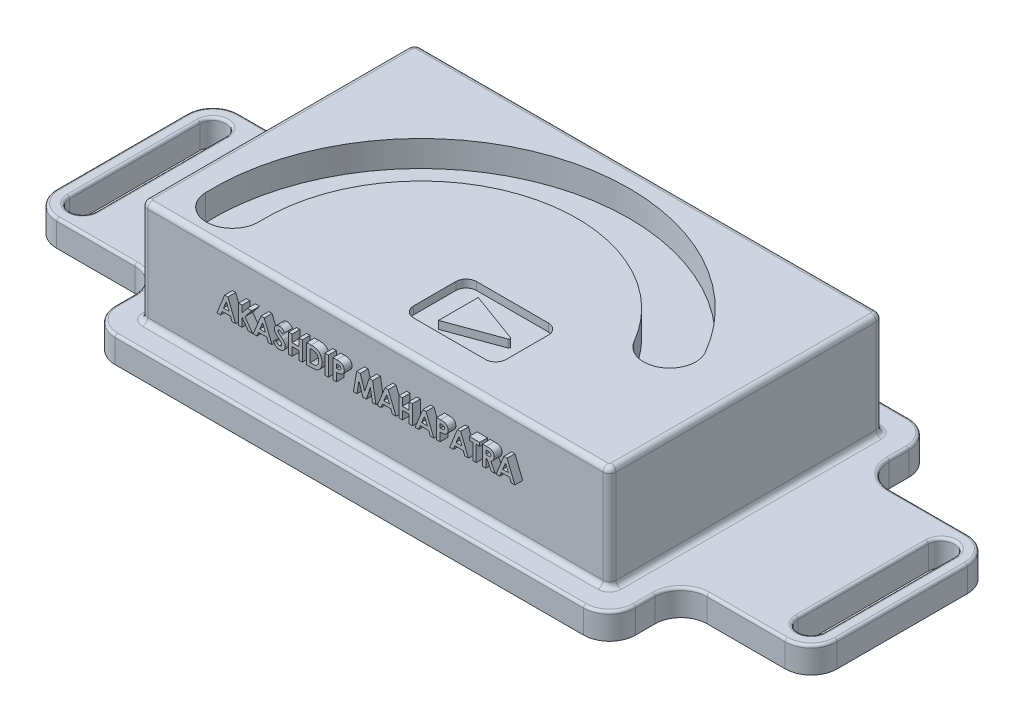
from build123d import *

# Parameters (mm, degrees)
SKETCH1_W           = 50
SKETCH1_H           = 70
BOSS_EXTRUDE1_DEPTH = 10
FILLET1_R           = 10
BOSS_EXTRUDE2_DEPTH = 40
FILLET2_R           = 2
CUT_EXTRUDE1_DEPTH  = 10
FILLET3_R           = 1
WRAP1_OUTLINE_W     = 1.329700854
WRAP1_OUTLINE_H     = 7.408333333
WRAP1_DEPTH         = 3
WRAP2_START         = -3
WRAP2_DEPTH         = 3


# Read off the part's stored shape, not the designer's step: Wrap1, Wrap2
with BuildPart() as part:
    # Sketch1 → Boss-Extrude1 (new body)
    # profile 1 of 5: a face of its own
    with BuildSketch(Plane(origin=(0, 0, 0), x_dir=(1, 0, 0), z_dir=(0, 1, 0))):
        with BuildLine():
            Line((140, 35), (100, 35))
            Line((100, 35), (100, -35))
            Line((100, -35), (140, -35))
            ThreePointArc((140, -35), (147.071067812, -32.071067812), (150, -25))
            Line((150, -25), (150, 25))
            ThreePointArc((150, 25), (147.071067812, 32.071067812), (140, 35))
        make_face()
        with BuildLine():
            Line((135, -25), (135, 25))
            ThreePointArc((135, 25), (140, 30), (145, 25))
            Line((145, 25), (145, -25))
            ThreePointArc((145, -25), (140, -30), (135, -25))
        make_face(mode=Mode.SUBTRACT)
    # profile 2 of 5: a face of its own
    with BuildSketch(Plane(origin=(0, 0, 0), x_dir=(1, 0, 0), z_dir=(0, 1, 0))):
        with Locations((75, 0)):
            Rectangle(SKETCH1_W, SKETCH1_H)
    # profile 3 of 5: a face of its own
    with BuildSketch(Plane(origin=(0, 0, 0), x_dir=(1, 0, 0), z_dir=(0, 1, 0))):
        with BuildLine():
            Line((90, 62.5), (-90, 62.5))
            ThreePointArc((-90, 62.5), (-97.071067812, 59.571067812), (-100, 52.5))
            Line((-100, 52.5), (-100, 35))
            Line((-100, 35), (-50, 35))
            Line((-50, 35), (-50, -35))
            Line((-50, -35), (-100, -35))
            Line((-100, -35), (-100, -52.5))
            ThreePointArc((-100, -52.5), (-97.071067812, -59.571067812), (-90, -62.5))
            Line((-90, -62.5), (90, -62.5))
            ThreePointArc((90, -62.5), (97.071067812, -59.571067812), (100, -52.5))
            Line((100, -52.5), (100, -35))
            Line((100, -35), (50, -35))
            Line((50, -35), (50, 35))
            Line((50, 35), (100, 35))
            Line((100, 35), (100, 52.5))
            ThreePointArc((100, 52.5), (97.071067812, 59.571067812), (90, 62.5))
        make_face()
    # profile 4 of 5: a face of its own
    with BuildSketch(Plane(origin=(0, 0, 0), x_dir=(1, 0, 0), z_dir=(0, 1, 0))):
        with Locations((-75, 0)):
            Rectangle(SKETCH1_W, SKETCH1_H)
    # profile 5 of 5: a face of its own
    with BuildSketch(Plane(origin=(0, 0, 0), x_dir=(1, 0, 0), z_dir=(0, 1, 0))):
        with BuildLine():
            Line((-100, -35), (-100, 35))
            Line((-100, 35), (-140, 35))
            ThreePointArc((-140, 35), (-147.071067812, 32.071067812), (-150, 25))
            Line((-150, 25), (-150, -25))
            ThreePointArc((-150, -25), (-147.071067812, -32.071067812), (-140, -35))
            Line((-140, -35), (-100, -35))
        make_face()
        with BuildLine():
            ThreePointArc((-145, 25), (-140, 30), (-135, 25))
            Line((-135, 25), (-135, -25))
            ThreePointArc((-135, -25), (-140, -30), (-145, -25))
            Line((-145, -25), (-145, 25))
        make_face(mode=Mode.SUBTRACT)
    extrude(amount=BOSS_EXTRUDE1_DEPTH)

    # Fillet1
    fillet1_edges = [part.edges().sort_by_distance(p)[0] for p in [
        (100, 5, -35),
        (100, 5, 35),
        (-100, 5, 35),
        (-100, 5, -35),
    ]]
    fillet(fillet1_edges, radius=FILLET1_R)

    # Sketch2 → Boss-Extrude2 (add)
    with BuildSketch(Plane(origin=(0, 10, 0), x_dir=(1, 0, 0), z_dir=(0, 1, 0))):
        with BuildLine():
            Line((-87.5, 52.5), (87.5, 52.5))
            ThreePointArc((87.5, 52.5), (89.267766953, 51.767766953), (90, 50))
            Line((90, 50), (90, -50))
            ThreePointArc((90, -50), (89.267766953, -51.767766953), (87.5, -52.5))
            Line((87.5, -52.5), (-87.5, -52.5))
            ThreePointArc((-87.5, -52.5), (-89.267766953, -51.767766953), (-90, -50))
            Line((-90, -50), (-90, 50))
            ThreePointArc((-90, 50), (-89.267766953, 51.767766953), (-87.5, 52.5))
        make_face()
    extrude(amount=BOSS_EXTRUDE2_DEPTH)

    # Fillet2
    fillet2_edges = [part.edges().sort_by_distance(p)[0] for p in [
        (89.267766953, 10, -51.767766953),
        (0, 10, -52.5),
        (-89.267766953, 10, -51.767766953),
        (-90, 10, 0),
        (-89.267766953, 10, 51.767766953),
        (0, 10, 52.5),
        (89.267766953, 10, 51.767766953),
        (90, 10, 0),
        (89.267766953, 50, -51.767766953),
        (0, 50, -52.5),
        (-89.267766953, 50, -51.767766953),
        (-90, 50, 0),
        (-89.267766953, 50, 51.767766953),
        (0, 50, 52.5),
        (89.267766953, 50, 51.767766953),
        (90, 50, 0),
    ]]
    fillet(fillet2_edges, radius=FILLET2_R)

    # Sketch3 → Cut-Extrude1 (cut)
    with BuildSketch(Plane(origin=(0, 50, 0), x_dir=(1, 0, 0), z_dir=(0, 1, 0))):
        with BuildLine():
            ThreePointArc((69.282032303, 5), (-22.082335197, 41.891940229), (-79.948963312, -37.857142857))
            ThreePointArc((-79.948963312, -37.857142857), (-69.598200041, -47.493620414), (-59.961722484, -37.142857143))
            ThreePointArc((-59.961722484, -37.142857143), (-16.561751398, 22.668955172), (51.961524227, -5))
            ThreePointArc((51.961524227, -5), (65.621778265, -8.660254038), (69.282032303, 5))
        make_face()
    extrude(amount=-CUT_EXTRUDE1_DEPTH, mode=Mode.SUBTRACT)

    # Fillet3
    fillet3_edges = [part.edges().sort_by_distance(p)[0] for p in [
        (145, 10, 0),
        (140, 10, 30),
        (135, 10, 0),
        (140, 10, -30),
        (-140, 10, 30),
        (-145, 10, 0),
        (-140, 10, -30),
        (-135, 10, 0),
        (-147.071067812, 10, -32.071067812),
        (-150, 10, 0),
        (-147.071067812, 10, 32.071067812),
        (-97.071067812, 10, 59.571067812),
        (0, 10, 62.5),
        (97.071067812, 10, 59.571067812),
        (147.071067812, 10, 32.071067812),
        (-100, 10, -48.75),
        (150, 10, 0),
        (147.071067812, 10, -32.071067812),
        (-125, 10, -35),
        (100, 10, -48.75),
        (-100, 10, 48.75),
        (-125, 10, 35),
        (97.071067812, 10, -59.571067812),
        (125, 10, -35),
        (125, 10, 35),
        (100, 10, 48.75),
        (-102.928932188, 10, -37.928932188),
        (0, 10, -62.5),
        (-102.928932188, 10, 37.928932188),
        (102.928932188, 10, -37.928932188),
        (102.928932188, 10, 37.928932188),
        (-97.071067812, 10, -59.571067812),
    ]]
    fillet(fillet3_edges, radius=FILLET3_R)

    # Wrap1 outline → Wrap1 (add)
    # profile 1 of 17: a face of its own
    with BuildSketch(Plane.XY.offset(52.5)):
        with BuildLine():
            add(Edge.make_bspline(
                [(-32.85559952, 35.308802516), (-32.898191392, 35.36888278), (-32.979961848, 35.484228508), (-33.112503227, 35.638679156), (-33.244446113, 35.770437053), (-33.377012878, 35.878951776), (-33.511378543, 35.963564016), (-33.647309868, 36.023470416), (-33.784036222, 36.061553483), (-33.875895225, 36.066295741), (-33.921141053, 36.068631576)],
                knots=[0, 0, 0, 0, 0.162420307, 0.31182434, 0.448432767, 0.573381197, 0.689077147, 0.797572901, 0.900293043, 1, 1, 1, 1], degree=3))
            Line((-32.85559952, 35.308802516), (-31.861291961, 36.21851973))
            add(Edge.make_bspline(
                [(-33.906300642, 37.39833243), (-33.81901379, 37.395139291), (-33.645129099, 37.388778219), (-33.388035568, 37.339036711), (-33.136917356, 37.26081295), (-32.934561594, 37.166444588), (-32.773550892, 37.075029912), (-32.650151229, 36.990866793), (-32.52458543, 36.894453417), (-32.395840884, 36.785485959), (-32.266309865, 36.66191133), (-32.132309186, 36.526671322), (-31.99566477, 36.378597143), (-31.906867565, 36.272813637), (-31.861291961, 36.21851973)],
                knots=[0, 0, 0, 0, 0.10691022, 0.212976528, 0.319776676, 0.428556273, 0.485856803, 0.546558687, 0.611431498, 0.67982091, 0.753158505, 0.830752869, 0.913133075, 1, 1, 1, 1], degree=3))
            add(Edge.make_bspline(
                [(-35.850394525, 35.519536357), (-35.848787564, 35.582962532), (-35.845621677, 35.707918912), (-35.817381475, 35.891649061), (-35.775175419, 36.068933217), (-35.713880108, 36.239124567), (-35.634326195, 36.402009939), (-35.537711058, 36.558386726), (-35.422534447, 36.706815671), (-35.292738182, 36.847198377), (-35.14973593, 36.975492194), (-34.99691985, 37.088724343), (-34.835154895, 37.184361862), (-34.665430662, 37.263700129), (-34.48669544, 37.324428532), (-34.300265962, 37.367475851), (-34.105874831, 37.393079024), (-33.97365418, 37.396559478), (-33.906300642, 37.39833243)],
                knots=[0, 0, 0, 0, 0.06317288, 0.12445736, 0.184840915, 0.244566821, 0.304319173, 0.365199786, 0.427420983, 0.491261689, 0.555499002, 0.618604518, 0.680494764, 0.742473305, 0.804990665, 0.868251971, 0.932887217, 1, 1, 1, 1], degree=3))
            add(Edge.make_bspline(
                [(-33.983470781, 32.919496292), (-34.077766347, 32.999279384), (-34.25874808, 33.152407284), (-34.514498229, 33.378572373), (-34.744952014, 33.589944372), (-34.948118987, 33.7891363), (-35.12658781, 33.972469546), (-35.279149814, 34.14143321), (-35.404129037, 34.297330618), (-35.53564272, 34.481980665), (-35.660607013, 34.706989435), (-35.768611624, 34.97770107), (-35.838680457, 35.248378355), (-35.846530696, 35.430096176), (-35.850394525, 35.519536357)],
                knots=[0, 0, 0, 0, 0.112124581, 0.215201009, 0.309902452, 0.395959096, 0.473447494, 0.542140328, 0.602523333, 0.654726333, 0.747804055, 0.835278417, 0.918925243, 1, 1, 1, 1], degree=3))
            add(Edge.make_bspline(
                [(-33.001035551, 31.641736877), (-33.003474883, 31.684010443), (-33.008430152, 31.769885145), (-33.044929139, 31.897567017), (-33.101988188, 32.025190823), (-33.169493067, 32.129871321), (-33.238187734, 32.217517464), (-33.30387533, 32.293458882), (-33.383865445, 32.377360855), (-33.47795526, 32.469328924), (-33.584901602, 32.570172707), (-33.704794561, 32.67988233), (-33.839007038, 32.797491382), (-33.933868681, 32.877605506), (-33.983470781, 32.919496292)],
                knots=[0, 0, 0, 0, 0.076346606, 0.155090822, 0.238351561, 0.32840414, 0.37938386, 0.439617644, 0.509831416, 0.588874645, 0.677436354, 0.77554672, 0.882635872, 1, 1, 1, 1], degree=3))
            add(Edge.make_bspline(
                [(-33.846938996, 30.939785422), (-33.78928309, 30.942117175), (-33.677422234, 30.946641115), (-33.517755177, 30.98842739), (-33.371366373, 31.054034907), (-33.244828973, 31.147647786), (-33.13768508, 31.255691277), (-33.058606737, 31.375894601), (-33.008929188, 31.505951696), (-33.003677067, 31.596297909), (-33.001035551, 31.641736877)],
                knots=[0, 0, 0, 0, 0.141985893, 0.275473311, 0.404345843, 0.535429711, 0.661427401, 0.77786684, 0.888279749, 1, 1, 1, 1], degree=3))
            add(Edge.make_bspline(
                [(-35.060884643, 31.889571747), (-35.01770716, 31.814518951), (-34.934932236, 31.670636327), (-34.794662389, 31.477311785), (-34.650963091, 31.311761316), (-34.500512144, 31.176911036), (-34.345138975, 31.070957821), (-34.184093096, 30.995236304), (-34.017261358, 30.94836477), (-33.903623157, 30.942640673), (-33.846938996, 30.939785422)],
                knots=[0, 0, 0, 0, 0.160457921, 0.307611547, 0.442138888, 0.566229194, 0.681222208, 0.789558005, 0.895028892, 1, 1, 1, 1], degree=3))
            Line((-35.060884643, 31.889571747), (-36.230309055, 31.187620291))
            add(Edge.make_bspline(
                [(-33.895912354, 29.610084567), (-33.959273199, 29.611208631), (-34.084764011, 29.613434921), (-34.269718496, 29.631610731), (-34.448312959, 29.660944554), (-34.620346229, 29.702988685), (-34.786593347, 29.756264302), (-34.947061141, 29.821338426), (-35.100641847, 29.899219684), (-35.248497531, 29.988306526), (-35.389909431, 30.091748084), (-35.526665644, 30.20742953), (-35.65740778, 30.337130096), (-35.782763765, 30.480543045), (-35.901931537, 30.638074488), (-36.018811884, 30.807530508), (-36.128210293, 30.99205598), (-36.195790557, 31.121502091), (-36.230309055, 31.187620291)],
                knots=[0, 0, 0, 0, 0.063551482, 0.125868382, 0.18624025, 0.244976651, 0.303357688, 0.361230317, 0.418489049, 0.475936712, 0.534203744, 0.594059429, 0.655468694, 0.718771685, 0.784974607, 0.853522316, 0.925182451, 1, 1, 1, 1], degree=3))
            add(Edge.make_bspline(
                [(-31.671334696, 31.718907016), (-31.672660799, 31.644086191), (-31.675262662, 31.497284947), (-31.707130492, 31.282463193), (-31.752572147, 31.076869451), (-31.822832917, 30.882740872), (-31.908466328, 30.696890894), (-32.015820176, 30.522214469), (-32.141892551, 30.3569438), (-32.28639085, 30.204033302), (-32.446223127, 30.065277624), (-32.617658434, 29.941754041), (-32.802373152, 29.839769591), (-32.998789108, 29.75579267), (-33.206801164, 29.691112522), (-33.426161516, 29.643307865), (-33.65720569, 29.614616264), (-33.815197025, 29.611616897), (-33.895912354, 29.610084567)],
                knots=[0, 0, 0, 0, 0.065200875, 0.127926544, 0.18904691, 0.248543693, 0.307607127, 0.36724766, 0.426963056, 0.488617128, 0.550391855, 0.611330734, 0.672556085, 0.734024191, 0.797340621, 0.862249627, 0.929625466, 1, 1, 1, 1], degree=3))
            add(Edge.make_bspline(
                [(-32.437099921, 33.418134113), (-32.3716958, 33.347352847), (-32.245966112, 33.211286397), (-32.082561839, 33.000426191), (-31.948074838, 32.794583635), (-31.844033143, 32.589885467), (-31.76545667, 32.383378299), (-31.710059216, 32.169997556), (-31.676881312, 31.947513542), (-31.67319779, 31.795695362), (-31.671334696, 31.718907016)],
                knots=[0, 0, 0, 0, 0.150833097, 0.289954183, 0.417138648, 0.535255184, 0.648751095, 0.762405462, 0.879826701, 1, 1, 1, 1], degree=3))
            add(Edge.make_bspline(
                [(-33.391338369, 34.272941805), (-33.329020209, 34.219008581), (-33.210753288, 34.116654526), (-33.042482945, 33.97137938), (-32.894601339, 33.840678873), (-32.764954172, 33.72651454), (-32.655506768, 33.627688536), (-32.565799011, 33.543728475), (-32.494735272, 33.476268904), (-32.454339698, 33.435523281), (-32.437099921, 33.418134113)],
                knots=[0, 0, 0, 0, 0.192952702, 0.366184141, 0.520457298, 0.655012135, 0.770624226, 0.865677185, 0.942674527, 1, 1, 1, 1], degree=3))
            add(Edge.make_bspline(
                [(-34.397518257, 35.228664295), (-34.380480757, 35.207155254), (-34.341262682, 35.157644282), (-34.266481845, 35.07922662), (-34.172572819, 34.983158121), (-34.055921788, 34.872742297), (-33.921371255, 34.744008166), (-33.762684631, 34.602016313), (-33.584429609, 34.442369417), (-33.457730068, 34.3311971), (-33.391338369, 34.272941805)],
                knots=[0, 0, 0, 0, 0.059234189, 0.136349281, 0.233805212, 0.349411224, 0.48317915, 0.635966856, 0.809243356, 1, 1, 1, 1], degree=3))
            add(Edge.make_bspline(
                [(-34.520693671, 35.583350125), (-34.519384942, 35.552514552), (-34.516749344, 35.490415991), (-34.491293053, 35.399402818), (-34.452923155, 35.310472353), (-34.416259151, 35.256336147), (-34.397518257, 35.228664295)],
                knots=[0, 0, 0, 0, 0.241881375, 0.487115475, 0.73783784, 1, 1, 1, 1], degree=3))
            add(Edge.make_bspline(
                [(-33.921141053, 36.068631576), (-33.963345064, 36.067151484), (-34.04482992, 36.064293816), (-34.160992627, 36.035888808), (-34.264123533, 35.986865935), (-34.354121986, 35.922764405), (-34.425414039, 35.845536922), (-34.482335215, 35.764545149), (-34.51438662, 35.675148549), (-34.518605216, 35.613747357), (-34.520693671, 35.583350125)],
                knots=[0, 0, 0, 0, 0.148126258, 0.285992887, 0.416634394, 0.547379946, 0.671582838, 0.784400739, 0.893265576, 1, 1, 1, 1], degree=3))
        make_face()
    # profile 2 of 17: a face of its own
    with BuildSketch(Plane.XY.offset(52.5)):
        with BuildLine():
            add(Edge.make_bspline(
                [(-21.732711232, 37.208375165), (-21.602088105, 37.207462065), (-21.349592122, 37.205697032), (-20.983775396, 37.185809351), (-20.643612392, 37.155223509), (-20.328883833, 37.113147141), (-20.040234965, 37.057468584), (-19.778037995, 36.987630747), (-19.541412926, 36.907014582), (-19.327765213, 36.812153306), (-19.132725401, 36.701554479), (-18.947528875, 36.578356265), (-18.772539263, 36.438045553), (-18.605300864, 36.283329217), (-18.447971924, 36.111376768), (-18.297932353, 35.925036364), (-18.158855801, 35.721605809), (-18.026538283, 35.505962728), (-17.906874696, 35.277193245), (-17.802499643, 35.0372446), (-17.715064029, 34.78766095), (-17.644018064, 34.528176305), (-17.587386231, 34.259652075), (-17.547762079, 33.981546402), (-17.523266033, 33.694116767), (-17.520781114, 33.499311591), (-17.519518457, 33.400325619)],
                knots=[0, 0, 0, 0, 0.060148162, 0.116267077, 0.168653955, 0.217398969, 0.262433523, 0.303932701, 0.342259967, 0.377441339, 0.411406099, 0.445398351, 0.479766387, 0.514584482, 0.550213651, 0.587000908, 0.624662987, 0.663615456, 0.703456428, 0.743450162, 0.784013386, 0.825132536, 0.867264663, 0.910306473, 0.954424205, 1, 1, 1, 1], degree=3))
            Line((-21.732711232, 37.208375165), (-23.408193671, 37.208375165))
            Line((-23.408193671, 37.208375165), (-23.408193671, 29.800041832))
            Line((-23.408193671, 29.800041832), (-21.707482533, 29.800041832))
            add(Edge.make_bspline(
                [(-17.519518457, 33.400325619), (-17.522824775, 33.260649971), (-17.529333455, 32.98569028), (-17.584158939, 32.582190102), (-17.672830311, 32.195394936), (-17.797510313, 31.828330446), (-17.95208014, 31.484265393), (-18.136731107, 31.169267222), (-18.348755801, 30.885026682), (-18.585684121, 30.632959058), (-18.842219788, 30.41630352), (-19.108812077, 30.230753906), (-19.388058082, 30.084432552), (-19.634112838, 29.991642933), (-19.847473009, 29.933935818), (-20.03480093, 29.899830357), (-20.247586336, 29.868553593), (-20.487813264, 29.844383582), (-20.754427891, 29.822829872), (-21.048492947, 29.811118425), (-21.369056333, 29.801387951), (-21.591717914, 29.800502296), (-21.707482533, 29.800041832)],
                knots=[0, 0, 0, 0, 0.065772947, 0.129477895, 0.191430088, 0.252445668, 0.311786958, 0.36881755, 0.424091518, 0.478492106, 0.531393744, 0.58200397, 0.631201271, 0.679503008, 0.705561374, 0.735221723, 0.769132486, 0.80685832, 0.848929771, 0.895116661, 0.945469804, 1, 1, 1, 1], degree=3))
        make_face()
        with BuildLine():
            add(Edge.make_bspline(
                [(-21.383961566, 31.129742687), (-21.301323014, 31.129894115), (-21.142381567, 31.130185361), (-20.912906096, 31.144057685), (-20.70069947, 31.157981673), (-20.506345845, 31.184409867), (-20.328430776, 31.213849016), (-20.16939835, 31.254817622), (-20.025970217, 31.297851672), (-19.899898324, 31.352639352), (-19.784426742, 31.414306532), (-19.677513247, 31.486556782), (-19.574311791, 31.566787961), (-19.476751808, 31.65735978), (-19.384464058, 31.757072899), (-19.297994572, 31.866441096), (-19.216189213, 31.985130684), (-19.141147768, 32.113769205), (-19.072574495, 32.250998208), (-19.011742317, 32.395488428), (-18.961303465, 32.54844316), (-18.919381779, 32.708430561), (-18.889423981, 32.876843505), (-18.864639618, 33.05243458), (-18.851862556, 33.235899463), (-18.850108984, 33.360735101), (-18.849219312, 33.424070278)],
                knots=[0, 0, 0, 0, 0.062614648, 0.120428813, 0.174199486, 0.223724664, 0.26902845, 0.310765001, 0.348115258, 0.382378114, 0.414753161, 0.447195432, 0.480044579, 0.513738641, 0.547962504, 0.582917814, 0.619315101, 0.657123545, 0.695686576, 0.735513716, 0.7758232, 0.817652262, 0.860742584, 0.905386927, 0.951998197, 1, 1, 1, 1], degree=3))
            Line((-21.383961566, 31.129742687), (-22.078492816, 31.129742687))
            Line((-22.078492816, 31.129742687), (-22.078492816, 35.878674311))
            Line((-22.078492816, 35.878674311), (-21.570950749, 35.878674311))
            add(Edge.make_bspline(
                [(-19.548202685, 35.285057858), (-19.603304163, 35.333284987), (-19.715842692, 35.431783437), (-19.913423366, 35.549809769), (-20.131147037, 35.653507471), (-20.373994568, 35.735728183), (-20.639618946, 35.800751828), (-20.929602236, 35.845597046), (-21.242391513, 35.874414108), (-21.459084637, 35.877223819), (-21.570950749, 35.878674311)],
                knots=[0, 0, 0, 0, 0.101663476, 0.207636138, 0.318744567, 0.436679942, 0.563506646, 0.698681208, 0.844446556, 1, 1, 1, 1], degree=3))
            add(Edge.make_bspline(
                [(-18.849219312, 33.424070278), (-18.850991237, 33.521125449), (-18.854446353, 33.710375512), (-18.887766749, 33.986022361), (-18.942005996, 34.245585162), (-19.019400176, 34.48810061), (-19.116957939, 34.714250299), (-19.239074221, 34.922118263), (-19.380493607, 35.115196398), (-19.4923242, 35.228462226), (-19.548202685, 35.285057858)],
                knots=[0, 0, 0, 0, 0.142276686, 0.277428514, 0.406477152, 0.530595072, 0.650142922, 0.766850697, 0.883502093, 1, 1, 1, 1], degree=3))
        make_face(mode=Mode.SUBTRACT)
    # profile 3 of 17: a face of its own
    with BuildSketch(Plane.XY.offset(52.5)):
        with BuildLine():
            add(Edge.make_bspline(
                [(-11.856417495, 37.208375165), (-11.759452173, 37.207941128), (-11.572385741, 37.207103779), (-11.302620555, 37.196949806), (-11.053748963, 37.178753269), (-10.825828142, 37.156265227), (-10.618951808, 37.124737867), (-10.43286089, 37.088594217), (-10.267516768, 37.044560731), (-10.121054943, 36.992293595), (-9.989610186, 36.930672683), (-9.86522105, 36.865042013), (-9.750698746, 36.786714123), (-9.640262984, 36.704130861), (-9.540227569, 36.609403079), (-9.444351693, 36.508835049), (-9.35669596, 36.398438324), (-9.276854206, 36.279549228), (-9.204425432, 36.154364324), (-9.14114681, 36.022659816), (-9.089818736, 35.884227297), (-9.046760864, 35.739962268), (-9.012176361, 35.589871017), (-8.989155816, 35.433030468), (-8.973519103, 35.270535741), (-8.972139379, 35.159941728), (-8.971441534, 35.104004839)],
                knots=[0, 0, 0, 0, 0.070781161, 0.136551696, 0.197012482, 0.252922694, 0.303686532, 0.349719151, 0.391240471, 0.428478555, 0.463056565, 0.497150358, 0.531002334, 0.564226377, 0.59770067, 0.631421421, 0.665597347, 0.700451436, 0.735880684, 0.771092108, 0.806974845, 0.843534403, 0.880940196, 0.919294384, 0.95918024, 1, 1, 1, 1], degree=3))
            Line((-11.856417495, 37.208375165), (-13.340458628, 37.208375165))
            Line((-13.340458628, 37.208375165), (-13.340458628, 29.800041832))
            Line((-13.340458628, 29.800041832), (-12.010757773, 29.800041832))
            Line((-12.010757773, 29.800041832), (-12.010757773, 33.029315336))
            add(Edge.make_bspline(
                [(-10.501487941, 33.142102462), (-10.539465642, 33.132653549), (-10.621737572, 33.11218416), (-10.757875019, 33.091402592), (-10.914759132, 33.072295218), (-11.092897221, 33.055874743), (-11.292391987, 33.044712647), (-11.513050266, 33.035995546), (-11.754972058, 33.029657313), (-11.923194906, 33.029432405), (-12.010757773, 33.029315336)],
                knots=[0, 0, 0, 0, 0.077372749, 0.167614291, 0.272108317, 0.390015992, 0.52136331, 0.667272254, 0.826809521, 1, 1, 1, 1], degree=3))
            add(Edge.make_bspline(
                [(-8.971441534, 35.104004839), (-8.972451228, 35.042123191), (-8.974435401, 34.920518149), (-8.993886692, 34.742260075), (-9.027115643, 34.572307141), (-9.070544143, 34.409226104), (-9.131102099, 34.255700007), (-9.200286719, 34.108065671), (-9.285405747, 33.970462309), (-9.382667843, 33.84116867), (-9.488889149, 33.719133535), (-9.606591353, 33.607880437), (-9.733531, 33.506650968), (-9.868973283, 33.414384236), (-10.013426693, 33.331266363), (-10.166786998, 33.256519038), (-10.330101431, 33.192532913), (-10.443828688, 33.159068687), (-10.501487941, 33.142102462)],
                knots=[0, 0, 0, 0, 0.068875425, 0.135348675, 0.199289315, 0.26155008, 0.322915384, 0.382771997, 0.442843572, 0.502652029, 0.562748843, 0.622739582, 0.682687332, 0.743329247, 0.805012514, 0.86806712, 0.933110571, 1, 1, 1, 1], degree=3))
        make_face()
        with BuildLine():
            add(Edge.make_bspline(
                [(-11.540316734, 34.359016191), (-11.45471256, 34.359558988), (-11.297199608, 34.360557742), (-11.082092538, 34.375000311), (-10.909228359, 34.397057031), (-10.772662447, 34.428691468), (-10.664830725, 34.476700915), (-10.571832615, 34.532238805), (-10.492065763, 34.602464942), (-10.422999409, 34.68271032), (-10.36778294, 34.774916281), (-10.329493195, 34.87758143), (-10.30462093, 34.988548662), (-10.302323745, 35.065774511), (-10.301142389, 35.105488881)],
                knots=[0, 0, 0, 0, 0.155159592, 0.285495954, 0.390502806, 0.470975045, 0.538445527, 0.60365534, 0.666587169, 0.73019895, 0.794944675, 0.860228437, 0.928120706, 1, 1, 1, 1], degree=3))
            Line((-11.540316734, 34.359016191), (-12.010757773, 34.359016191))
            Line((-12.010757773, 34.359016191), (-12.010757773, 35.878674311))
            Line((-12.010757773, 35.878674311), (-11.592258174, 35.878674311))
            add(Edge.make_bspline(
                [(-10.649892055, 35.731754239), (-10.673409901, 35.743647888), (-10.723202001, 35.76882918), (-10.808002774, 35.798104274), (-10.905861571, 35.822801041), (-11.01743905, 35.843299119), (-11.142290096, 35.859207756), (-11.280392432, 35.871373884), (-11.431949291, 35.876266357), (-11.537348018, 35.877849521), (-11.592258174, 35.878674311)],
                knots=[0, 0, 0, 0, 0.08210116, 0.173824981, 0.278953094, 0.396639095, 0.527315592, 0.671298143, 0.82875438, 1, 1, 1, 1], degree=3))
            add(Edge.make_bspline(
                [(-10.301142389, 35.105488881), (-10.302311593, 35.140186808), (-10.304580131, 35.207509129), (-10.321245426, 35.304671938), (-10.347805114, 35.395247719), (-10.38628908, 35.478290529), (-10.436039736, 35.553659265), (-10.496695853, 35.621324236), (-10.567479094, 35.682734545), (-10.622127895, 35.71523996), (-10.649892055, 35.731754239)],
                knots=[0, 0, 0, 0, 0.137787685, 0.267341238, 0.390444331, 0.511777883, 0.629508981, 0.747829066, 0.87188531, 1, 1, 1, 1], degree=3))
        make_face(mode=Mode.SUBTRACT)
    # profile 4 of 17: a face of its own
    with BuildSketch(Plane.XY.offset(52.5)):
        with BuildLine():
            add(Edge.make_bspline(
                [(28.034608146, 37.208375165), (28.131573468, 37.207941128), (28.3186399, 37.207103779), (28.588405086, 37.196949806), (28.837276678, 37.178753269), (29.065197499, 37.156265227), (29.272073833, 37.124737867), (29.458164752, 37.088594217), (29.623508873, 37.044560731), (29.769970698, 36.992293595), (29.901415455, 36.930672683), (30.025804591, 36.865042013), (30.140326895, 36.786714123), (30.250762657, 36.704130861), (30.350798072, 36.609403079), (30.446673948, 36.508835049), (30.534329681, 36.398438324), (30.614171435, 36.279549228), (30.686600209, 36.154364324), (30.749878831, 36.022659816), (30.801206905, 35.884227297), (30.844264777, 35.739962268), (30.87884928, 35.589871017), (30.901869826, 35.433030468), (30.917506538, 35.270535741), (30.918886262, 35.159941728), (30.919584107, 35.104004839)],
                knots=[0, 0, 0, 0, 0.070781161, 0.136551696, 0.197012482, 0.252922694, 0.303686532, 0.349719151, 0.391240471, 0.428478555, 0.463056565, 0.497150358, 0.531002334, 0.564226377, 0.59770067, 0.631421421, 0.665597347, 0.700451436, 0.735880684, 0.771092108, 0.806974845, 0.843534403, 0.880940196, 0.919294384, 0.95918024, 1, 1, 1, 1], degree=3))
            Line((28.034608146, 37.208375165), (26.550567013, 37.208375165))
            Line((26.550567013, 37.208375165), (26.550567013, 29.800041832))
            Line((26.550567013, 29.800041832), (27.880267868, 29.800041832))
            Line((27.880267868, 29.800041832), (27.880267868, 33.029315336))
            add(Edge.make_bspline(
                [(29.3895377, 33.142102462), (29.351559999, 33.132653549), (29.269288069, 33.11218416), (29.133150622, 33.091402592), (28.976266509, 33.072295218), (28.79812842, 33.055874743), (28.598633654, 33.044712647), (28.377975375, 33.035995546), (28.136053583, 33.029657313), (27.967830735, 33.029432405), (27.880267868, 33.029315336)],
                knots=[0, 0, 0, 0, 0.077372749, 0.167614291, 0.272108317, 0.390015992, 0.52136331, 0.667272254, 0.826809521, 1, 1, 1, 1], degree=3))
            add(Edge.make_bspline(
                [(30.919584107, 35.104004839), (30.918574413, 35.042123191), (30.91659024, 34.920518149), (30.897138949, 34.742260075), (30.863909998, 34.572307141), (30.820481498, 34.409226104), (30.759923542, 34.255700007), (30.690738922, 34.108065671), (30.605619894, 33.970462309), (30.508357798, 33.84116867), (30.402136492, 33.719133535), (30.284434288, 33.607880437), (30.157494641, 33.506650968), (30.022052358, 33.414384236), (29.877598948, 33.331266363), (29.724238643, 33.256519038), (29.56092421, 33.192532913), (29.447196953, 33.159068687), (29.3895377, 33.142102462)],
                knots=[0, 0, 0, 0, 0.068875425, 0.135348675, 0.199289315, 0.26155008, 0.322915384, 0.382771997, 0.442843572, 0.502652029, 0.562748843, 0.622739582, 0.682687332, 0.743329247, 0.805012514, 0.86806712, 0.933110571, 1, 1, 1, 1], degree=3))
        make_face()
        with BuildLine():
            add(Edge.make_bspline(
                [(28.350708907, 34.359016191), (28.436313081, 34.359558988), (28.593826033, 34.360557742), (28.808933103, 34.375000311), (28.981797283, 34.397057031), (29.118363194, 34.428691468), (29.226194916, 34.476700915), (29.319193026, 34.532238805), (29.398959878, 34.602464942), (29.468026232, 34.68271032), (29.523242701, 34.774916281), (29.561532446, 34.87758143), (29.586404711, 34.988548662), (29.588701896, 35.065774511), (29.589883252, 35.105488881)],
                knots=[0, 0, 0, 0, 0.155159592, 0.285495954, 0.390502806, 0.470975045, 0.538445527, 0.60365534, 0.666587169, 0.73019895, 0.794944675, 0.860228437, 0.928120706, 1, 1, 1, 1], degree=3))
            Line((28.350708907, 34.359016191), (27.880267868, 34.359016191))
            Line((27.880267868, 34.359016191), (27.880267868, 35.878674311))
            Line((27.880267868, 35.878674311), (28.298767467, 35.878674311))
            add(Edge.make_bspline(
                [(29.241133586, 35.731754239), (29.21761574, 35.743647888), (29.16782364, 35.76882918), (29.083022867, 35.798104274), (28.98516407, 35.822801041), (28.873586591, 35.843299119), (28.748735545, 35.859207756), (28.610633209, 35.871373884), (28.45907635, 35.876266357), (28.353677623, 35.877849521), (28.298767467, 35.878674311)],
                knots=[0, 0, 0, 0, 0.08210116, 0.173824981, 0.278953094, 0.396639095, 0.527315592, 0.671298143, 0.82875438, 1, 1, 1, 1], degree=3))
            add(Edge.make_bspline(
                [(29.589883252, 35.105488881), (29.588714048, 35.140186808), (29.58644551, 35.207509129), (29.569780215, 35.304671938), (29.543220527, 35.395247719), (29.504736561, 35.478290529), (29.454985905, 35.553659265), (29.394329788, 35.621324236), (29.323546547, 35.682734545), (29.268897746, 35.71523996), (29.241133586, 35.731754239)],
                knots=[0, 0, 0, 0, 0.137787685, 0.267341238, 0.390444331, 0.511777883, 0.629508981, 0.747829066, 0.87188531, 1, 1, 1, 1], degree=3))
        make_face(mode=Mode.SUBTRACT)
    # profile 5 of 17: a face of its own
    with BuildSketch(Plane.XY.offset(52.5)):
        with BuildLine():
            add(Edge.make_bspline(
                [(45.670952964, 37.208375165), (45.773363796, 37.208011666), (45.970328675, 37.207312553), (46.254341272, 37.196282413), (46.5152459, 37.180933069), (46.753428852, 37.157509561), (46.968788231, 37.126452821), (47.161539875, 37.089842063), (47.331678152, 37.048116256), (47.480637942, 36.996122609), (47.615066787, 36.937474563), (47.74037316, 36.870086882), (47.859321506, 36.79470995), (47.971116782, 36.709360396), (48.076730518, 36.615573638), (48.176361959, 36.513255268), (48.26860322, 36.401537671), (48.352883141, 36.281126759), (48.429697504, 36.154457241), (48.497585291, 36.021355199), (48.552791752, 35.881728069), (48.601572578, 35.737593765), (48.636707827, 35.586891858), (48.661143878, 35.431089458), (48.679034999, 35.269638123), (48.680063653, 35.159955255), (48.680588381, 35.104004839)],
                knots=[0, 0, 0, 0, 0.072889027, 0.14018613, 0.202277434, 0.258895132, 0.310482942, 0.357095244, 0.398513567, 0.435037511, 0.469251486, 0.502805028, 0.536210446, 0.56937936, 0.602801475, 0.636665798, 0.670928657, 0.705803, 0.741189061, 0.776304311, 0.812004301, 0.847968976, 0.884521761, 0.921974159, 0.960198176, 1, 1, 1, 1], degree=3))
            Line((45.670952964, 37.208375165), (44.121614022, 37.208375165))
            Line((44.121614022, 37.208375165), (44.121614022, 29.800041832))
            Line((44.121614022, 29.800041832), (45.451314876, 29.800041832))
            Line((45.451314876, 29.800041832), (45.451314876, 33.029315336))
            Line((45.451314876, 33.029315336), (45.902463381, 33.029315336))
            Line((45.902463381, 33.029315336), (47.534908626, 29.800041832))
            Line((47.534908626, 29.800041832), (49.013013594, 29.800041832))
            Line((49.013013594, 29.800041832), (47.30339821, 33.180687532))
            add(Edge.make_bspline(
                [(48.680588381, 35.104004839), (48.679225327, 35.045605459), (48.676552628, 34.931094917), (48.662156017, 34.762888271), (48.635843535, 34.601959917), (48.595989452, 34.448781034), (48.55018236, 34.301445133), (48.489270678, 34.162670653), (48.420525825, 34.030439319), (48.338879572, 33.906621595), (48.249276797, 33.788467242), (48.145070655, 33.68050319), (48.033012103, 33.576926781), (47.906801921, 33.484225691), (47.772003572, 33.396131805), (47.625938755, 33.316295284), (47.469560738, 33.242709222), (47.359619247, 33.201672551), (47.30339821, 33.180687532)],
                knots=[0, 0, 0, 0, 0.068741263, 0.134789088, 0.19853605, 0.260385651, 0.320961578, 0.37990385, 0.438502936, 0.496154344, 0.554265483, 0.612748761, 0.672513443, 0.733646402, 0.796789619, 0.861935699, 0.929397735, 1, 1, 1, 1], degree=3))
        make_face()
        with BuildLine():
            add(Edge.make_bspline(
                [(45.969245232, 34.359016191), (46.032566523, 34.359729358), (46.153813189, 34.361094919), (46.328181821, 34.367428959), (46.486550123, 34.382690866), (46.629598182, 34.401973715), (46.758045804, 34.424238548), (46.870747281, 34.456145406), (46.96943917, 34.490334412), (47.05295197, 34.532822478), (47.124303387, 34.581140625), (47.185910769, 34.63603124), (47.236868907, 34.699560138), (47.278810054, 34.770000877), (47.311435706, 34.847976488), (47.335249933, 34.932630976), (47.348558564, 35.024928664), (47.350089768, 35.088626636), (47.350887526, 35.121813333)],
                knots=[0, 0, 0, 0, 0.105539996, 0.202086415, 0.290684899, 0.37055261, 0.442670262, 0.507674928, 0.565573203, 0.616454666, 0.663331357, 0.708862024, 0.7534118, 0.798515011, 0.845064321, 0.893873119, 0.944707806, 1, 1, 1, 1], degree=3))
            Line((45.969245232, 34.359016191), (45.451314876, 34.359016191))
            Line((45.451314876, 34.359016191), (45.451314876, 35.878674311))
            Line((45.451314876, 35.878674311), (45.903947422, 35.878674311))
            add(Edge.make_bspline(
                [(47.350887526, 35.121813333), (47.349379291, 35.161075618), (47.346416643, 35.238199102), (47.317017968, 35.349229876), (47.270221629, 35.451996453), (47.206076666, 35.54603451), (47.125294423, 35.628474762), (47.032590426, 35.7011465), (46.925963899, 35.758609874), (46.827235759, 35.796512103), (46.737416228, 35.819189398), (46.656356936, 35.836088317), (46.562489787, 35.848065067), (46.455743917, 35.860768541), (46.336391425, 35.869006101), (46.203781769, 35.875017878), (46.058295802, 35.877477592), (45.956878265, 35.878263919), (45.903947422, 35.878674311)],
                knots=[0, 0, 0, 0, 0.06376896, 0.125262305, 0.185413583, 0.246806762, 0.309422389, 0.372532682, 0.437733251, 0.505749517, 0.544013263, 0.588369599, 0.640389019, 0.697897401, 0.763271619, 0.834978604, 0.913873656, 1, 1, 1, 1], degree=3))
        make_face(mode=Mode.SUBTRACT)
    # profile 6 of 17: a face of its own
    with BuildSketch(Plane.XY.offset(52.5)):
        Polygon((-52.134777872, 29.800041832), (-50.714550508, 29.800041832), (-53.706377431, 37.208375165), (-54.939615612, 37.208375165), (-57.932926577, 29.800041832), (-56.514183254, 29.800041832), (-55.938375295, 31.319699952), (-52.710585831, 31.319699952), align=None)
        Polygon((-54.323738542, 35.221244089), (-53.213675775, 32.649400806), (-55.43380131, 32.649400806), align=None, mode=Mode.SUBTRACT)
    # profile 7 of 17: a face of its own
    with BuildSketch(Plane.XY.offset(52.5)):
        Polygon((-48.29259538, 33.274182123), (-45.857283882, 29.800041832), (-44.2560035, 29.800041832), (-47.15285179, 33.931612345), (-44.512742616, 37.208375165), (-46.191193136, 37.208375165), (-48.29259538, 34.600914896), (-48.29259538, 37.208375165), (-49.622296235, 37.208375165), (-49.622296235, 29.800041832), (-48.29259538, 29.800041832), align=None)
    # profile 8 of 17: a face of its own
    with BuildSketch(Plane.XY.offset(52.5)):
        Polygon((-38.748726857, 31.319699952), (-38.172918898, 29.800041832), (-36.752691534, 29.800041832), (-39.744518457, 37.208375165), (-40.977756638, 37.208375165), (-43.971067602, 29.800041832), (-42.55232428, 29.800041832), (-41.97651632, 31.319699952), align=None)
        Polygon((-40.361879568, 35.221244089), (-39.251816801, 32.649400806), (-41.471942335, 32.649400806), align=None, mode=Mode.SUBTRACT)
    # profile 9 of 17: a face of its own
    with BuildSketch(Plane.XY.offset(52.5)):
        Polygon((-26.44750991, 33.029315336), (-26.44750991, 29.800041832), (-25.117809055, 29.800041832), (-25.117809055, 37.208375165), (-26.44750991, 37.208375165), (-26.44750991, 34.359016191), (-29.011932987, 34.359016191), (-29.011932987, 37.208375165), (-30.341633842, 37.208375165), (-30.341633842, 29.800041832), (-29.011932987, 29.800041832), (-29.011932987, 33.029315336), align=None)
    # profile 10 of 17: a face of its own
    with BuildSketch(Plane.XY.offset(52.5)):
        with Locations((-15.71492444, 33.504208498)):
            Rectangle(WRAP1_OUTLINE_W, WRAP1_OUTLINE_H)
    # profile 11 of 17: a face of its own
    with BuildSketch(Plane.XY.offset(52.5)):
        Polygon((1.048804193, 34.479223523), (1.839798116, 29.800041832), (3.185823423, 29.800041832), (1.933292708, 37.208375165), (0.566490825, 37.208375165), (-1.135704354, 32.040943942), (-2.826027204, 37.208375165), (-4.206185458, 37.208375165), (-5.457232132, 29.800041832), (-4.109722784, 29.800041832), (-3.320212901, 34.479223523), (-1.788682453, 29.800041832), (-0.491630503, 29.800041832), align=None)
    # profile 12 of 17: a face of its own
    with BuildSketch(Plane.XY.offset(52.5)):
        Polygon((8.930546647, 31.319699952), (9.506354607, 29.800041832), (10.92658197, 29.800041832), (7.934755047, 37.208375165), (6.701516866, 37.208375165), (3.708205902, 29.800041832), (5.126949225, 29.800041832), (5.702757184, 31.319699952), align=None)
        Polygon((7.317393936, 35.221244089), (8.427456703, 32.649400806), (6.207331169, 32.649400806), align=None, mode=Mode.SUBTRACT)
    # profile 13 of 17: a face of its own
    with BuildSketch(Plane.XY.offset(52.5)):
        Polygon((15.912960176, 33.029315336), (15.912960176, 29.800041832), (17.24266103, 29.800041832), (17.24266103, 37.208375165), (15.912960176, 37.208375165), (15.912960176, 34.359016191), (13.348537099, 34.359016191), (13.348537099, 37.208375165), (12.018836244, 37.208375165), (12.018836244, 29.800041832), (13.348537099, 29.800041832), (13.348537099, 33.029315336), align=None)
    # profile 14 of 17: a face of its own
    with BuildSketch(Plane.XY.offset(52.5)):
        Polygon((23.462277416, 31.319699952), (24.038085376, 29.800041832), (25.45831274, 29.800041832), (22.466485817, 37.208375165), (21.233247635, 37.208375165), (18.239936671, 29.800041832), (19.658679994, 29.800041832), (20.234487953, 31.319699952), align=None)
        Polygon((21.849124705, 35.221244089), (22.959187473, 32.649400806), (20.739061938, 32.649400806), align=None, mode=Mode.SUBTRACT)
    # profile 15 of 17: a face of its own
    with BuildSketch(Plane.XY.offset(52.5)):
        Polygon((36.759285963, 31.319699952), (37.335093923, 29.800041832), (38.755321287, 29.800041832), (35.763494364, 37.208375165), (34.530256182, 37.208375165), (31.536945218, 29.800041832), (32.955688541, 29.800041832), (33.5314965, 31.319699952), align=None)
        Polygon((35.146133252, 35.221244089), (36.25619602, 32.649400806), (34.036070485, 32.649400806), align=None, mode=Mode.SUBTRACT)
    # profile 16 of 17: a face of its own
    with BuildSketch(Plane.XY.offset(52.5)):
        Polygon((40.417447355, 35.878674311), (40.417447355, 29.800041832), (41.74714821, 29.800041832), (41.74714821, 35.878674311), (43.076849064, 35.878674311), (43.076849064, 37.208375165), (39.0877465, 37.208375165), (39.0877465, 35.878674311), align=None)
    # profile 17 of 17: a face of its own
    with BuildSketch(Plane.XY.offset(52.5)):
        Polygon((54.615268869, 31.319699952), (55.191076829, 29.800041832), (56.611304193, 29.800041832), (53.61947727, 37.208375165), (52.386239088, 37.208375165), (49.392928124, 29.800041832), (50.811671447, 29.800041832), (51.387479406, 31.319699952), align=None)
        Polygon((53.002116158, 35.221244089), (54.112178926, 32.649400806), (51.892053391, 32.649400806), align=None, mode=Mode.SUBTRACT)
    extrude(amount=WRAP1_DEPTH)

    # Wrap2 outline → Wrap2 (cut)
    with BuildSketch(Plane(origin=(0, 50, 0), x_dir=(1, 0, 0), z_dir=(0, 1, 0)).offset(WRAP2_START)):
        with BuildLine():
            ThreePointArc((33.369764914, -19.364838317), (32.198192039, -16.536411192), (29.369764914, -15.364838317))
            Line((29.369764914, -15.364838317), (1.746854632, -15.364838317))
            ThreePointArc((1.746854632, -15.364838317), (-1.081572493, -16.536411192), (-2.253145368, -19.364838317))
            Line((-2.253145368, -19.364838317), (-2.253145368, -35.588417309))
            ThreePointArc((-2.253145368, -35.588417309), (-1.081572493, -38.416844434), (1.746854632, -39.588417309))
            Line((1.746854632, -39.588417309), (29.369764914, -39.588417309))
            ThreePointArc((29.369764914, -39.588417309), (32.198192038, -38.416844433), (33.369764914, -35.588417309))
            Line((33.369764914, -35.588417309), (33.369764914, -19.364838317))
        make_face()
        with BuildLine():
            ThreePointArc((26.952952227, -27.501879776), (27.281594547, -27.971599422), (26.952952227, -28.441319068))
            Line((26.952952227, -28.441319068), (7.361577841, -35.588417309))
            Line((7.361577841, -35.588417309), (7.361577841, -20.354781535))
            Line((7.361577841, -20.354781535), (26.952952227, -27.501879776))
        make_face(mode=Mode.SUBTRACT)
    extrude(amount=WRAP2_DEPTH, mode=Mode.SUBTRACT)


solid = part.part
